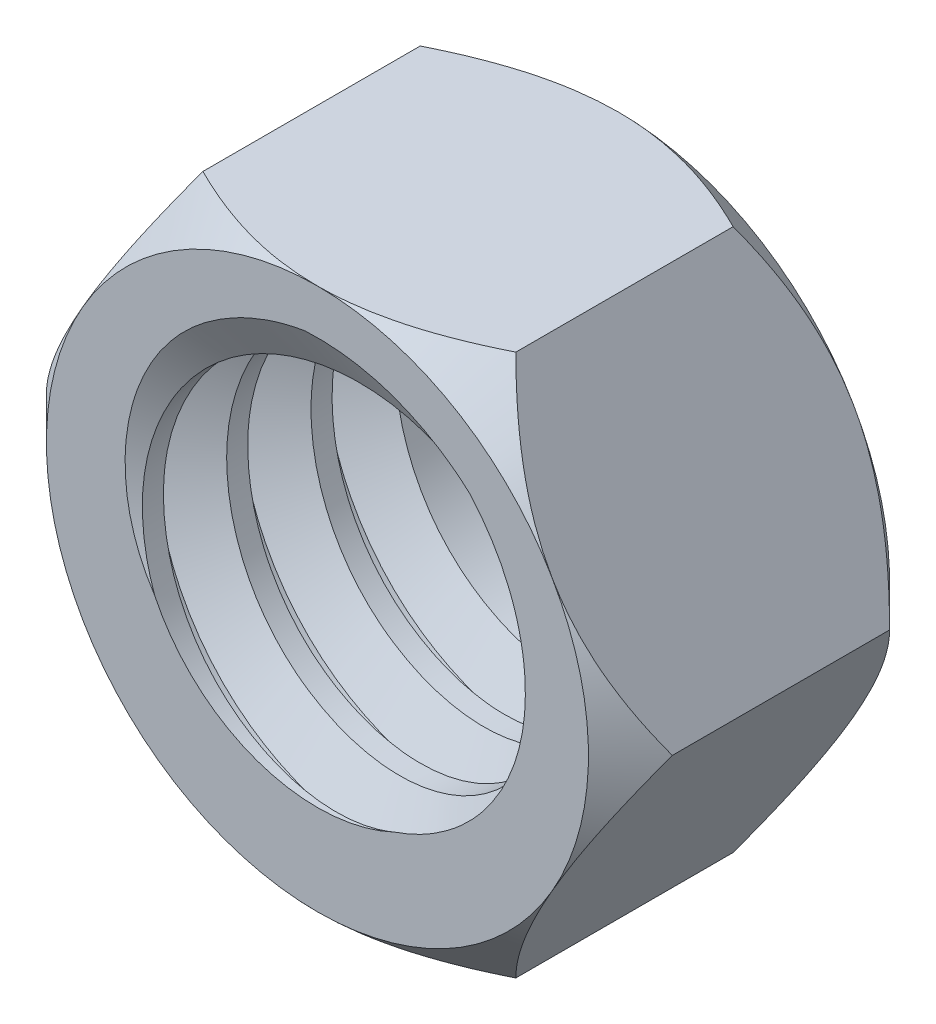
from build123d import *

# Parameters (mm, degrees)
BOSS_EXTRUDE1_DEPTH = 2.5
CUT_EXTRUDE1_REACH  = 6.25
SKETCH1_3_R         = 1.5
SKETCH1_4_OUTSIDE_W = 10.658
SKETCH1_4_OUTSIDE_H = 9.962
SKETCH1_4_OUTSIDE_R = 2.25
CUT_EXTRUDE2_DEPTH  = 1
CUT_EXTRUDE2_DRAFT  = 45
SKETCH2_OUTSIDE_W   = 10.658
SKETCH2_OUTSIDE_H   = 9.962
SKETCH2_OUTSIDE_R   = 2.25
CUT_EXTRUDE3_DEPTH  = 1
CUT_EXTRUDE3_DRAFT  = -45
THREAD1_PITCH       = 0.7


with BuildPart() as part:
    # Sketch1 → Boss-Extrude1 (new body)
    with BuildSketch(Plane.XY):
        Polygon((2.598076211, 0), (1.299038106, 2.25), (-1.299038106, 2.25), (-2.598076211, 0), (-1.299038106, -2.25), (1.299038106, -2.25), align=None)
    extrude(amount=BOSS_EXTRUDE1_DEPTH)

    # Sketch1<3> → Cut-Extrude1 (cut, up to next)
    with BuildSketch(Plane.XY, mode=Mode.PRIVATE) as cut_extrude1_sk1:
        Circle(SKETCH1_3_R)
    cut_extrude1_tool1 = extrude(cut_extrude1_sk1.sketch, amount=CUT_EXTRUDE1_REACH, mode=Mode.PRIVATE) & part.part
    add(cut_extrude1_tool1.solids().sort_by_distance((0, 0, 0))[0], mode=Mode.SUBTRACT)


with BuildPart() as cut_extrude2_tool:
    # Sketch1<4> outside → Cut-Extrude2 (with draft: the straight prism first)
    with BuildSketch(Plane.XY):
        Rectangle(SKETCH1_4_OUTSIDE_W, SKETCH1_4_OUTSIDE_H)
        Circle(SKETCH1_4_OUTSIDE_R, mode=Mode.SUBTRACT)
    extrude(amount=CUT_EXTRUDE2_DEPTH)
    # Cut-Extrude2: the draft: its side faces are tilted about the plane it starts from
    cut_extrude2_sides = [cut_extrude2_tool.faces().sort_by_distance(p)[0] for p in [
        (0, -4.981, 0.5),
        (5.329, 0, 0.5),
        (0, 4.981, 0.5),
        (-5.329, 0, 0.5),
        (-2.25, 0, 0.5),
    ]]
    draft(cut_extrude2_sides, Plane.XY, CUT_EXTRUDE2_DRAFT)


with BuildPart() as part_1:
    add(part.part)

    # Cut-Extrude2: cut by cut_extrude2_tool
    add(cut_extrude2_tool.part, mode=Mode.SUBTRACT)


with BuildPart() as cut_extrude3_tool:
    # Sketch2 outside → Cut-Extrude3 (with draft: the straight prism first)
    with BuildSketch(Plane.XY.offset(2.5)):
        Rectangle(SKETCH2_OUTSIDE_W, SKETCH2_OUTSIDE_H)
        Circle(SKETCH2_OUTSIDE_R, mode=Mode.SUBTRACT)
    extrude(amount=-CUT_EXTRUDE3_DEPTH)
    # Cut-Extrude3: the draft: its side faces are tilted about the plane it starts from
    cut_extrude3_sides = [cut_extrude3_tool.faces().sort_by_distance(p)[0] for p in [
        (0, -4.981, 2),
        (5.329, 0, 2),
        (0, 4.981, 2),
        (-5.329, 0, 2),
        (-2.25, 0, 2),
    ]]
    draft(cut_extrude3_sides, Plane.XY.offset(2.5), CUT_EXTRUDE3_DRAFT)


with BuildPart() as part_2:
    add(part_1.part)

    # Cut-Extrude3: cut by cut_extrude3_tool
    add(cut_extrude3_tool.part, mode=Mode.SUBTRACT)

    # Thread1: the profile of Thread Profile1 profile screwed along a right-hand helix of 3.571429 turns, 6 arcs to a turn; built about Z, then put on its axis
    thread1_z = Axis((0, 0, 0), (0, 0, 1))
    thread1_corners = [(1.4997, 0, -0.000173205), (1.878886113, 0, 0.218749999), (1.878886113, 0, 0.306249999), (1.4997, 0, 0.525173203)]
    with BuildLine(mode=Mode.PRIVATE) as thread1_profile:
        Line(thread1_corners[0], thread1_corners[1])
        Line(thread1_corners[1], thread1_corners[2])
        Line(thread1_corners[2], thread1_corners[3])
        Line(thread1_corners[3], thread1_corners[0])
    thread1_cap = Face(thread1_profile.wire())
    thread1_turn_angles = [0, 30, 60, 90, 120, 150, 180, 210, 240, 270, 300, 330, 360]
    thread1_turn_weights = [1, 0.8660254037844387, 1, 0.8660254037844387, 1, 0.8660254037844387, 1, 0.8660254037844387, 1, 0.8660254037844387, 1, 0.8660254037844387, 1]
    thread1_turn_rails = [Edge.make_bspline([Vector(p[0], p[1], 0).rotate(thread1_z, thread1_turn_angles[k]) / thread1_turn_weights[k] + Vector(0, 0, p[2] + THREAD1_PITCH * thread1_turn_angles[k] / 360) for k in range(13)], [0, 0, 0, 1, 1, 2, 2, 3, 3, 4, 4, 5, 5, 6, 6, 6], 2, thread1_turn_weights) for p in thread1_corners]
    thread1_turn_sides = [Face.make_surface_from_curves(thread1_turn_rails[p[0]], thread1_turn_rails[p[1]]) for p in [(0, 1), (1, 2), (2, 3), (3, 0)]]
    thread1_last_angles = [1080, 1110, 1140, 1170, 1200, 1230, 1260, 1272.857142857, 1285.714285714]
    thread1_last_weights = [1, 0.8660254037844387, 1, 0.8660254037844387, 1, 0.8660254037844387, 1, 0.9749279121818235, 1]
    thread1_last_rails = [Edge.make_bspline([Vector(p[0], p[1], 0).rotate(thread1_z, thread1_last_angles[k]) / thread1_last_weights[k] + Vector(0, 0, p[2] + THREAD1_PITCH * thread1_last_angles[k] / 360) for k in range(9)], [0, 0, 0, 1, 1, 2, 2, 3, 3, 4, 4, 4], 2, thread1_last_weights) for p in thread1_corners]
    thread1_last_sides = [Face.make_surface_from_curves(thread1_last_rails[p[0]], thread1_last_rails[p[1]]) for p in [(0, 1), (1, 2), (2, 3), (3, 0)]]
    thread1 = Plane(origin=(0, 0, 0), x_dir=(1, 0, 0), z_dir=(0, 0, 1)) * Solid(Shell([*[p.moved(Location((0, 0, THREAD1_PITCH * i))) for i in range(3) for p in thread1_turn_sides], *thread1_last_sides, thread1_cap, thread1_cap.rotate(thread1_z, 1285.714285714).moved(Location((0, 0, THREAD1_PITCH * 1285.714285714 / 360)))]))
    add(thread1, mode=Mode.SUBTRACT)


solid = part_2.part
